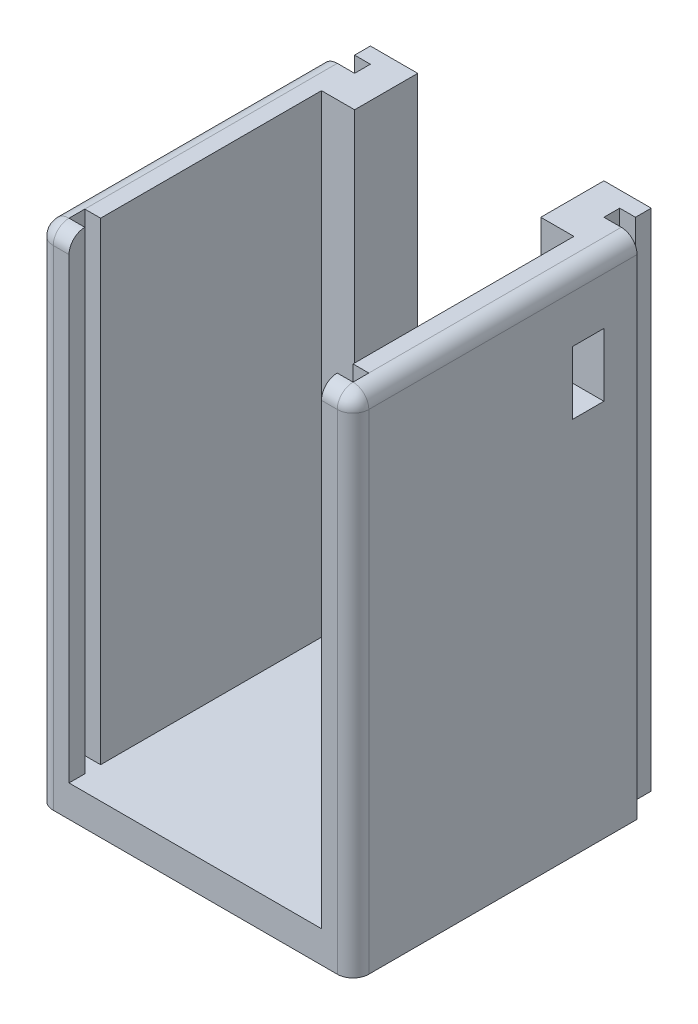
from build123d import *

# Parameters (mm, degrees)
BOSS_EXTRUDE1_DEPTH = 160
SHELL1_START        = -80
SHELL1_OUTLINE_W    = 80
SHELL1_OUTLINE_H    = 150
SHELL1_DEPTH        = 80
SHELL1_START_2      = -100
SHELL1_2_OUTLINE_W  = 59
SHELL1_2_OUTLINE_H  = 150
SHELL1_2_DEPTH      = 20
SKETCH2_W           = 5
SKETCH2_H           = 5
CUT_EXTRUDE1_DEPTH  = 150
FILLET1_R           = 5
SKETCH4_W           = 10
SKETCH4_H           = 20
CUT_EXTRUDE2_DEPTH  = 10


# Read off the part's stored shape, not the designer's step: Shell1
with BuildPart() as part:
    # Sketch1 → Boss-Extrude1 (new body)
    with BuildSketch(Plane(origin=(0, 0, 0), x_dir=(1, 0, 0), z_dir=(0, 1, 0))):
        Polygon((50, 0), (-50, 0), (-50, 90), (-39.5, 90), (-39.5, 95), (-44.5, 95), (-44.5, 100), (44.5, 100), (44.5, 95), (39.5, 95), (39.5, 90), (50, 90), align=None)
    extrude(amount=BOSS_EXTRUDE1_DEPTH)

    # Shell1 outline → Shell1 (cut)
    with BuildSketch(Plane.XY.offset(SHELL1_START)):
        with Locations((0, 85)):
            Rectangle(SHELL1_OUTLINE_W, SHELL1_OUTLINE_H)
    extrude(amount=SHELL1_DEPTH, mode=Mode.SUBTRACT)

    # Shell1 2 outline → Shell1 2 (cut)
    with BuildSketch(Plane.XY.offset(SHELL1_START_2)):
        with Locations((0, 85)):
            Rectangle(SHELL1_2_OUTLINE_W, SHELL1_2_OUTLINE_H)
    extrude(amount=SHELL1_2_DEPTH, mode=Mode.SUBTRACT)

    # Sketch2 → Cut-Extrude1 (cut)
    with BuildSketch(Plane(origin=(0, 160, 0), x_dir=(1, 0, 0), z_dir=(0, 1, 0))):
        with Locations((-42.5, 7.5)):
            Rectangle(SKETCH2_W, SKETCH2_H)
        with Locations((42.5, 7.5)):
            Rectangle(SKETCH2_W, SKETCH2_H)
    extrude(amount=-CUT_EXTRUDE1_DEPTH, mode=Mode.SUBTRACT)

    # Fillet1
    fillet1_edges = [part.edges().sort_by_distance(p)[0] for p in [
        (45, 160, 0),
        (-45, 160, 0),
        (50, 160, -45),
        (-50, 160, -45),
        (50, 80, 0),
        (-50, 80, 0),
    ]]
    fillet(fillet1_edges, radius=FILLET1_R - 0.0001)  # a hair under: the kernel refuses the full size

    # Sketch4 → Cut-Extrude2 (cut)
    with BuildSketch(Plane(origin=(50, 0, 0), x_dir=(0, 0, -1), z_dir=(1, 0, 0))):
        with Locations((74.5, 130)):
            Rectangle(SKETCH4_W, SKETCH4_H)
    extrude(amount=-CUT_EXTRUDE2_DEPTH, mode=Mode.SUBTRACT)


solid = part.part
